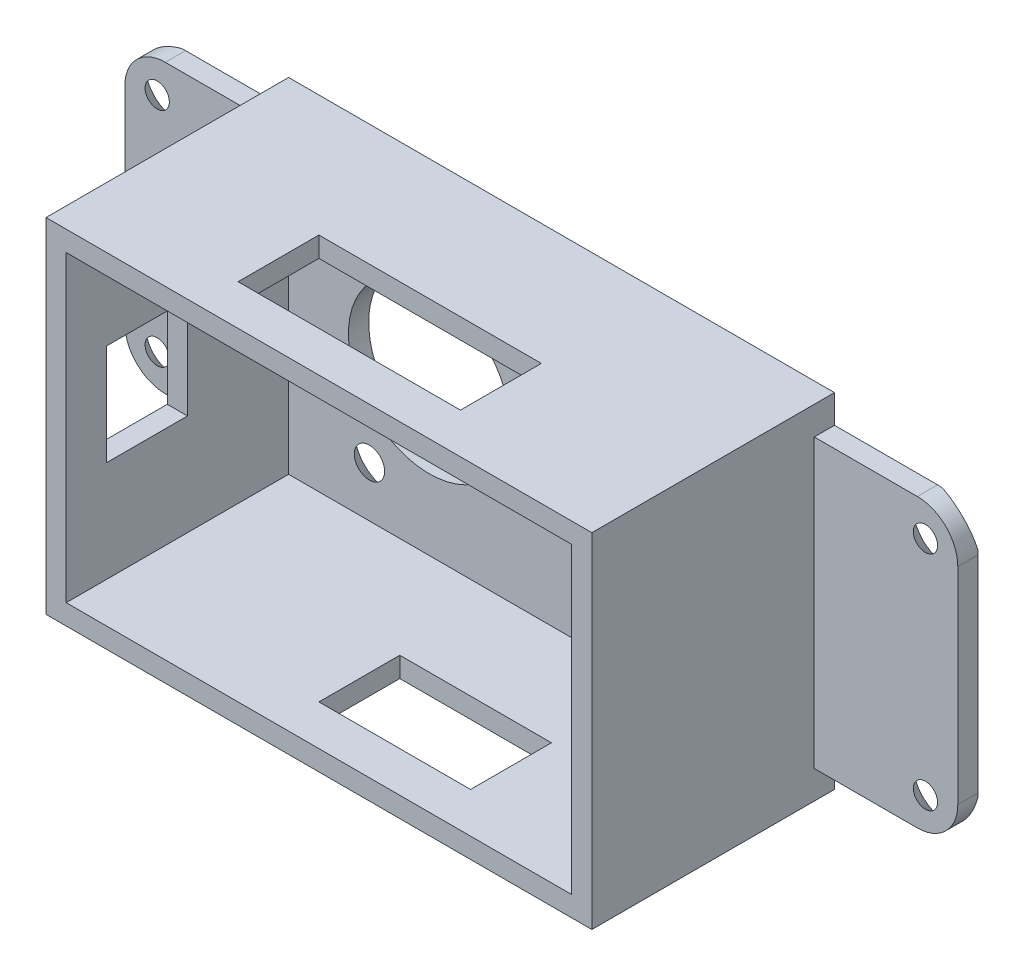
from build123d import *

# Parameters (mm, degrees)
ESBO_O1_W                = 54
ESBO_O1_H                = 34
RESSALTO_EXTRUS_O1_DEPTH = 2
ESBO_O2_W                = 54
ESBO_O2_H                = 34
ESBO_O2_W_2              = 50
ESBO_O2_H_2              = 30
RESSALTO_EXTRUS_O2_DEPTH = 22
ESBO_O3_R                = 1.5
CORTE_EXTRUS_O1_DEPTH    = 4
ESBO_O4_R                = 1.5
CORTE_EXTRUS_O2_DEPTH    = 4
ESBO_O5_R                = 7
CORTE_EXTRUS_O3_DEPTH    = 4
ESBO_O7_W                = 22
ESBO_O7_H                = 8
CORTE_EXTRUS_O4_DEPTH    = 4
ESBO_O8_W                = 15
ESBO_O8_H                = 8
CORTE_EXTRUS_O5_DEPTH    = 4
ESBO_O9_W                = 8
ESBO_O9_H                = 10
CORTE_EXTRUS_O6_DEPTH    = 4
ESBO_O10_W               = 15
ESBO_O10_H               = 34
RESSALTO_EXTRUS_O3_DEPTH = 2
ESBO_O11_W               = 0.5
ESBO_O11_H               = 34
CORTE_EXTRUS_O7_DEPTH    = 4
ESBO_O12_R               = 1.2
CORTE_EXTRUS_O8_DEPTH    = 4
ESBO_O13_R               = 1.5
CORTE_EXTRUS_O9_DEPTH    = 10
ESBO_O14_W               = 18.172080502
ESBO_O14_H               = 24.820402638
RESSALTO_EXTRUS_O4_DEPTH = 2
ESBO_O15_W               = 4.609503347
ESBO_O15_H               = 25.795489883
RESSALTO_EXTRUS_O5_DEPTH = 2
ESBO_O16_R               = 8
CORTE_EXTRUS_O10_DEPTH   = 2
ESBO_O17_W               = 14.5
ESBO_O17_H               = 2.8
CORTE_EXTRUS_O11_DEPTH   = 10
ESBO_O18_W               = 0.3
ESBO_O18_H               = 28.4
CORTE_EXTRUS_O12_DEPTH   = 10
FILETE1_R                = 4
ESBO_O19_W               = 2
ESBO_O19_H               = 8
RESSALTO_EXTRUS_O6_DEPTH = 2
CHANFRO3_SIZE            = 2
CHANFRO4_SIZE            = 2
CHANFRO5_SIZE            = 2
CHANFRO7_SIZE            = 2
CORTE_EXTRUS_O13_DEPTH   = 0.5


# Some blends are built 0.0001 mm under size
with BuildPart() as part:
    # Esboço1 → Ressalto-extrusão1 (new body)
    with BuildSketch(Plane.XY):
        with Locations((27, 17)):
            Rectangle(ESBO_O1_W, ESBO_O1_H)
    extrude(amount=RESSALTO_EXTRUS_O1_DEPTH)

    # Esboço2 → Ressalto-extrusão2 (add)
    with BuildSketch(Plane.XY.offset(2)):
        with Locations((27, 17)):
            Rectangle(ESBO_O2_W, ESBO_O2_H)
        with Locations((27, 17)):
            Rectangle(ESBO_O2_W_2, ESBO_O2_H_2, mode=Mode.SUBTRACT)
    extrude(amount=RESSALTO_EXTRUS_O2_DEPTH)

    # Esboço3 → Corte-extrusão1 (cut)
    with BuildSketch(Plane.XY.offset(2)):
        with Locations((48, 27)):
            Circle(ESBO_O3_R)
        with Locations((48, 7)):
            Circle(ESBO_O3_R)
    extrude(amount=-CORTE_EXTRUS_O1_DEPTH, mode=Mode.SUBTRACT)

    # Esboço4 → Corte-extrusão2 (cut)
    with BuildSketch(Plane.XY.offset(2)):
        with Locations((14, 7)):
            Circle(ESBO_O4_R)
        with Locations((14, 27)):
            Circle(ESBO_O4_R)
    extrude(amount=-CORTE_EXTRUS_O2_DEPTH, mode=Mode.SUBTRACT)

    # Esboço5 → Corte-extrusão3 (cut)
    with BuildSketch(Plane.XY.offset(2)):
        with Locations((19.92, 17)):
            Circle(ESBO_O5_R)
    extrude(amount=-CORTE_EXTRUS_O3_DEPTH, mode=Mode.SUBTRACT)

    # Esboço7 → Corte-extrusão4 (cut)
    with BuildSketch(Plane(origin=(0, 34, 0), x_dir=(1, 0, 0), z_dir=(0, 1, 0))):
        with Locations((26, -16)):
            Rectangle(ESBO_O7_W, ESBO_O7_H)
    extrude(amount=-CORTE_EXTRUS_O4_DEPTH, mode=Mode.SUBTRACT)

    # Esboço8 → Corte-extrusão5 (cut)
    with BuildSketch(Plane(origin=(0, 0, 0), x_dir=(-1, 0, 0), z_dir=(0, -1, 0))):
        with Locations((-30.5, -16)):
            Rectangle(ESBO_O8_W, ESBO_O8_H)
    extrude(amount=-CORTE_EXTRUS_O5_DEPTH, mode=Mode.SUBTRACT)

    # Esboço9 → Corte-extrusão6 (cut)
    with BuildSketch(Plane.ZY):
        with Locations((16, 17)):
            Rectangle(ESBO_O9_W, ESBO_O9_H)
    extrude(amount=-CORTE_EXTRUS_O6_DEPTH, mode=Mode.SUBTRACT)

    # Esboço10 → Ressalto-extrusão3 (add)
    with BuildSketch(Plane(origin=(0, 0, 0), x_dir=(-1, 0, 0), z_dir=(0, 0, -1))):
        Polygon((-69, 0), (-54, 0), (-54, 34), (-69, 34), (-69, 17), align=None)
        with Locations((7.5, 17)):
            Rectangle(ESBO_O10_W, ESBO_O10_H)
    extrude(amount=-RESSALTO_EXTRUS_O3_DEPTH)

    # Esboço11 → Corte-extrusão7 (cut)
    with BuildSketch(Plane(origin=(0, 0, 0), x_dir=(-1, 0, 0), z_dir=(0, 0, -1))):
        with Locations((-68.75, 17)):
            Rectangle(ESBO_O11_W, ESBO_O11_H)
        with Locations((14.75, 17)):
            Rectangle(ESBO_O11_W, ESBO_O11_H)
    extrude(amount=-CORTE_EXTRUS_O7_DEPTH, mode=Mode.SUBTRACT)

    # Esboço12 → Corte-extrusão8 (cut)
    with BuildSketch(Plane(origin=(0, 0, 0), x_dir=(-1, 0, 0), z_dir=(0, 0, -1))):
        with Locations((-65, 28)):
            Circle(ESBO_O12_R)
        with Locations((-65, 6)):
            Circle(ESBO_O12_R)
        with Locations((11, 6)):
            Circle(ESBO_O12_R)
        with Locations((11, 28)):
            Circle(ESBO_O12_R)
    extrude(amount=-CORTE_EXTRUS_O8_DEPTH, mode=Mode.SUBTRACT)

    # Esboço13 → Corte-extrusão9 (cut)
    with BuildSketch(Plane.XY.offset(2)):
        with Locations((44, 27)):
            Circle(ESBO_O13_R)
        with Locations((44, 7)):
            Circle(ESBO_O13_R)
        with Locations((10, 27)):
            Circle(ESBO_O13_R)
        with Locations((10, 7)):
            Circle(ESBO_O13_R)
    extrude(amount=-CORTE_EXTRUS_O9_DEPTH, mode=Mode.SUBTRACT)

    # Esboço14 → Ressalto-extrusão4 (add)
    with BuildSketch(Plane.XY.offset(2)):
        with Locations((20.750577193, 17.221610738)):
            Rectangle(ESBO_O14_W, ESBO_O14_H)
    extrude(amount=-RESSALTO_EXTRUS_O4_DEPTH)

    # Esboço15 → Ressalto-extrusão5 (add)
    with BuildSketch(Plane.XY.offset(2)):
        with Locations((48.363275128, 16.64542282)):
            Rectangle(ESBO_O15_W, ESBO_O15_H)
    extrude(amount=-RESSALTO_EXTRUS_O5_DEPTH)

    # Esboço16 → Corte-extrusão10 (cut)
    with BuildSketch(Plane.XY.offset(2)):
        with Locations((15.92, 17)):
            Circle(ESBO_O16_R)
    extrude(amount=-CORTE_EXTRUS_O10_DEPTH, mode=Mode.SUBTRACT)

    # Esboço17 → Corte-extrusão11 (cut)
    with BuildSketch(Plane.XY.offset(2)):
        with Locations((-7.25, 32.6)):
            Rectangle(ESBO_O17_W, ESBO_O17_H)
        with Locations((61.25, 32.6)):
            Rectangle(ESBO_O17_W, ESBO_O17_H)
        with Locations((61.25, 1.4)):
            Rectangle(ESBO_O17_W, ESBO_O17_H)
        with Locations((-7.25, 1.4)):
            Rectangle(ESBO_O17_W, ESBO_O17_H)
    extrude(amount=-CORTE_EXTRUS_O11_DEPTH, mode=Mode.SUBTRACT)

    # Esboço18 → Corte-extrusão12 (cut)
    with BuildSketch(Plane.XY.offset(2)):
        with Locations((-14.35, 17)):
            Rectangle(ESBO_O18_W, ESBO_O18_H)
        with Locations((68.35, 17)):
            Rectangle(ESBO_O18_W, ESBO_O18_H)
    extrude(amount=-CORTE_EXTRUS_O12_DEPTH, mode=Mode.SUBTRACT)

    # Filete1
    filete1_edges = [part.edges().sort_by_distance(p)[0] for p in [
        (-14.2, 2.8, 1),
        (68.2, 2.8, 1),
        (-14.2, 31.2, 1),
        (68.2, 31.2, 1),
    ]]
    fillet(filete1_edges, radius=FILETE1_R)

    # Esboço19 → Ressalto-extrusão6 (add)
    with BuildSketch(Plane(origin=(0, 34, 0), x_dir=(1, 0, 0), z_dir=(0, 1, 0))):
        with Locations((38, -16)):
            Rectangle(ESBO_O19_W, ESBO_O19_H)
    extrude(amount=-RESSALTO_EXTRUS_O6_DEPTH)

    # Chanfro3
    chanfro3_edges = [part.edges().sort_by_distance(p)[0] for p in [
        (8.5, 7, 0),
    ]]
    chamfer(chanfro3_edges, length=CHANFRO3_SIZE - 0.0001)  # a hair under: the kernel refuses the full size

    # Chanfro4
    chanfro4_edges = [part.edges().sort_by_distance(p)[0] for p in [
        (42.5, 7, 0),
    ]]
    chamfer(chanfro4_edges, length=CHANFRO4_SIZE - 0.0001)  # a hair under: the kernel refuses the full size

    # Chanfro5
    # the kernel refuses this chamfer: 2 mm, written as the material it takes off along each edge
    with BuildSketch(Plane(origin=(65, 6, 0), x_dir=(-1, 0, 0), z_dir=(0, -1, 0))) as chanfro5_piece_1:
        Polygon((1.2 + CHANFRO5_SIZE, 0), (1.2, -CHANFRO5_SIZE), (1.2, 0), align=None)
    revolve(axis=Axis((65, 6, 0), (0, 0, -1)), mode=Mode.SUBTRACT)
    with BuildSketch(Plane(origin=(65, 28, 0), x_dir=(-1, 0, 0), z_dir=(0, -1, 0))) as chanfro5_piece_2:
        Polygon((1.2 + CHANFRO5_SIZE, 0), (1.2, -CHANFRO5_SIZE), (1.2, 0), align=None)
    revolve(axis=Axis((65, 28, 0), (0, 0, -1)), mode=Mode.SUBTRACT)
    with BuildSketch(Plane(origin=(10, 27, 0), x_dir=(1, 0, 0), z_dir=(0, -1, 0))) as chanfro5_piece_3:
        Polygon((1.5 + CHANFRO5_SIZE, 0), (1.5, CHANFRO5_SIZE), (1.5, 0), align=None)
    revolve(axis=Axis((10, 27, 0), (0, 0, 1)), mode=Mode.SUBTRACT)
    with BuildSketch(Plane(origin=(44, 27, 0), x_dir=(1, 0, 0), z_dir=(0, -1, 0))) as chanfro5_piece_4:
        Polygon((1.5 + CHANFRO5_SIZE, 0), (1.5, CHANFRO5_SIZE), (1.5, 0), align=None)
    revolve(axis=Axis((44, 27, 0), (0, 0, 1)), mode=Mode.SUBTRACT)

    # Chanfro7
    # the kernel refuses this chamfer: 2 mm, written as the material it takes off along each edge
    with BuildSketch(Plane(origin=(-11, 28, 0), x_dir=(-1, 0, 0), z_dir=(0, -1, 0))) as chanfro7_piece_1:
        Polygon((1.2 + CHANFRO7_SIZE, 0), (1.2, -CHANFRO7_SIZE), (1.2, 0), align=None)
    revolve(axis=Axis((-11, 28, 0), (0, 0, -1)), mode=Mode.SUBTRACT)
    with BuildSketch(Plane(origin=(-11, 6, 0), x_dir=(-1, 0, 0), z_dir=(0, -1, 0))) as chanfro7_piece_2:
        Polygon((1.2 + CHANFRO7_SIZE, 0), (1.2, -CHANFRO7_SIZE), (1.2, 0), align=None)
    revolve(axis=Axis((-11, 6, 0), (0, 0, -1)), mode=Mode.SUBTRACT)

    # Esboço20 → Corte-extrusão13 (cut)
    # profile 1 of 9: a face of its own
    with BuildSketch(Plane(origin=(0, 0, 0), x_dir=(-1, 0, 0), z_dir=(0, 0, -1))):
        with BuildLine():
            Line((-64.341648744, 17.170569536), (-63.253310638, 16.562033945))
            add(Edge.make_bspline(
                [(-63.253310638, 16.562033945), (-63.270020556, 17.33554905), (-62.813419169, 18.489492684), (-61.807502214, 19.759396766), (-60.143049425, 20.961016733), (-58.489526243, 21.257442003), (-57.325086229, 20.995462515)],
                knots=[0, 0, 0, 0, 0.269048478, 0.436762832, 0.575078585, 1, 1, 1, 1], degree=3))
            add(Edge.make_bspline(
                [(-57.325086229, 20.995462515), (-56.650111252, 20.957693306), (-57.782985527, 21.288511272)],
                knots=[0, 0, 0, 1, 1, 1], degree=2))
            add(Edge.make_bspline(
                [(-57.782985527, 21.288511272), (-58.347802927, 21.447990439), (-59.878608985, 21.522292306), (-61.356202699, 21.053790774), (-62.150011012, 20.559292652)],
                knots=[0, 0, 0, 0, 0.385958971, 1, 1, 1, 1], degree=3))
            add(Edge.make_bspline(
                [(-62.150011012, 20.559292652), (-62.7877961, 20.128686199), (-63.253310638, 19.519599113)],
                knots=[0, 0, 0, 1, 1, 1], degree=2))
            add(Edge.make_bspline(
                [(-63.253310638, 19.519599113), (-63.896310724, 19.534543448), (-64.816721669, 19.466477979), (-66.082799255, 19.167755988), (-66.928993529, 18.906271975), (-67.591738491, 18.342841648), (-67.716909049, 17.554159212), (-67.201169221, 16.709575449), (-66.034826519, 15.798936837), (-65.043136259, 15.137590569), (-64.341648744, 14.82717935)],
                knots=[0, 0, 0, 0, 0.199805318, 0.283821629, 0.403978318, 0.472066119, 0.541253762, 0.630997506, 0.763360147, 1, 1, 1, 1], degree=3))
            add(Edge.make_bspline(
                [(-64.341648744, 14.82717935), (-64.271185726, 13.977816701), (-63.500872393, 12.655393424), (-61.867914467, 11.402421013), (-60.031444391, 10.597092063), (-58.643927495, 10.724275687), (-57.908403654, 10.824357369)],
                knots=[0, 0, 0, 0, 0.29975622, 0.520241987, 0.730809474, 1, 1, 1, 1], degree=3))
            add(Edge.make_bspline(
                [(-57.908403654, 10.824357369), (-57.552932155, 10.91131631), (-58.093396597, 10.909757264)],
                knots=[0, 0, 0, 1, 1, 1], degree=2))
            add(Edge.make_bspline(
                [(-58.093396597, 10.909757264), (-58.597138627, 10.921165487), (-59.359693088, 10.989296436), (-60.51894411, 11.412230368), (-61.854197866, 12.247879996), (-62.594602543, 13.376988435), (-62.908556765, 14.13614406)],
                knots=[0, 0, 0, 0, 0.246282106, 0.366938776, 0.598193981, 1, 1, 1, 1], degree=3))
            add(Edge.make_bspline(
                [(-62.908556765, 14.13614406), (-62.07018749, 13.883830813), (-60.782949289, 13.279057457), (-58.842303432, 12.829318761), (-57.308894504, 12.465946458), (-55.73038208, 12.174490979), (-53.731864974, 11.780344634), (-52.15811274, 11.685675227), (-51.156439711, 11.599039125)],
                knots=[0, 0, 0, 0, 0.217613669, 0.350859611, 0.494055954, 0.609441159, 0.749783707, 1, 1, 1, 1], degree=3))
            add(Edge.make_bspline(
                [(-51.156439711, 11.599039125), (-50.565418006, 11.571750557), (-51.489168444, 11.73385607)],
                knots=[0, 0, 0, 1, 1, 1], degree=2))
            add(Edge.make_bspline(
                [(-51.489168444, 11.73385607), (-52.362535462, 11.967042102), (-53.881877975, 12.37270648), (-56.077202541, 13.064524773), (-58.0955537, 13.745776856), (-60.240047229, 14.470030905), (-62.612522445, 15.508519024), (-64.470021974, 16.25198519), (-65.888206899, 17.642327818), (-65.124947829, 18.509213539), (-64.401736383, 18.935173102), (-63.857541949, 19.102726949), (-63.573361471, 19.058890062)],
                knots=[0, 0, 0, 0, 0.14943301, 0.259821698, 0.380461345, 0.501235571, 0.635113932, 0.801941109, 0.854496238, 0.910360712, 0.953252466, 1, 1, 1, 1], degree=3))
            add(Edge.make_bspline(
                [(-63.573361471, 19.058890062), (-63.82901343, 18.738418293), (-64.118386916, 18.111949736), (-64.312631636, 17.450285411), (-64.341648744, 17.170569536)],
                knots=[0, 0, 0, 0, 0.591386289, 1, 1, 1, 1], degree=3))
        make_face()
    # profile 2 of 9: a face of its own
    with BuildSketch(Plane(origin=(0, 0, 0), x_dir=(-1, 0, 0), z_dir=(0, 0, -1))):
        with BuildLine():
            Line((-58.77564974, 18.060259572), (-56.101515737, 18.060259572))
            Line((-56.101515737, 18.060259572), (-56.016312523, 18.762062937))
            Line((-56.016312523, 18.762062937), (-58.938786283, 18.772498652))
            add(Edge.make_bspline(
                [(-58.938786283, 18.772498652), (-59.449114022, 18.662346686), (-59.868523704, 17.727035504), (-59.248418664, 16.974858294), (-58.882320278, 16.86630174)],
                knots=[0, 0, 0, 0, 0.54475329, 1, 1, 1, 1], degree=3))
            Line((-58.882320278, 16.86630174), (-56.734939991, 16.86630174))
            add(Edge.make_bspline(
                [(-56.734939991, 16.393586892), (-56.436095176, 16.611687057), (-56.734939991, 16.86630174)],
                knots=[0, 0, 0, 1, 1, 1], degree=2))
            Line((-56.734939991, 16.393586892), (-59.452603219, 16.393586892))
            Line((-59.452603219, 16.393586892), (-59.597581247, 15.694978548))
            Line((-59.597581247, 15.694978548), (-56.619507795, 15.694978548))
            add(Edge.make_bspline(
                [(-56.619507795, 17.555217314), (-55.753830359, 17.431820921), (-55.66879501, 15.950374101), (-56.619507795, 15.694978548)],
                knots=[0, 0, 0, 0, 1, 1, 1, 1], degree=3))
            Line((-56.619507795, 17.555217314), (-58.77564974, 17.555217314))
            add(Edge.make_bspline(
                [(-58.77564974, 18.060259572), (-58.937193472, 17.944800948), (-58.944156276, 17.668426138), (-58.77564974, 17.555217314)],
                knots=[0, 0, 0, 0, 1, 1, 1, 1], degree=3))
        make_face()
    # profile 3 of 9: a face of its own
    with BuildSketch(Plane(origin=(0, 0, 0), x_dir=(-1, 0, 0), z_dir=(0, 0, -1))):
        with BuildLine():
            Line((-55.138481136, 18.762062937), (-55.138481136, 18.060259572))
            Line((-55.138481136, 18.060259572), (-52.132489773, 18.060259572))
            add(Edge.make_bspline(
                [(-52.132489773, 18.060259572), (-51.862020444, 17.936540453), (-51.914614766, 17.56996039), (-52.101734743, 17.411237838)],
                knots=[0, 0, 0, 0, 1, 1, 1, 1], degree=3))
            Line((-52.101734743, 17.411237838), (-54.683118266, 17.411237838))
            add(Edge.make_bspline(
                [(-54.683118266, 17.411237838), (-54.888072601, 17.408515629), (-55.131403748, 17.222296939), (-55.102966038, 16.999988217)],
                knots=[0, 0, 0, 0, 1, 1, 1, 1], degree=3))
            Line((-55.102966038, 16.999988217), (-55.102966038, 15.694978548))
            Line((-55.102966038, 15.694978548), (-54.405671123, 15.694978548))
            Line((-54.405671123, 15.694978548), (-54.405671123, 16.598144366))
            add(Edge.make_bspline(
                [(-54.325984863, 16.707005318), (-54.436423373, 16.722519532), (-54.405671123, 16.598144366)],
                knots=[0, 0, 0, 1, 1, 1], degree=2))
            Line((-54.325984863, 16.707005318), (-52.035073316, 16.707005318))
            add(Edge.make_bspline(
                [(-52.132489773, 18.772498652), (-51.749440216, 18.83821921), (-51.389763079, 18.37455441), (-51.225624941, 17.447784669), (-51.582977848, 16.809744391), (-52.035073316, 16.707005318)],
                knots=[0, 0, 0, 0, 0.351621802, 0.539318988, 1, 1, 1, 1], degree=3))
            Line((-52.132489773, 18.772498652), (-55.138481136, 18.762062937))
        make_face()
    # profile 4 of 9: a face of its own
    with BuildSketch(Plane(origin=(0, 0, 0), x_dir=(-1, 0, 0), z_dir=(0, 0, -1))):
        with BuildLine():
            Line((-50.479863026, 15.74914417), (-49.784461806, 15.74914417))
            Line((-49.784461806, 15.74914417), (-49.784461806, 17.828784413))
            Line((-49.784461806, 17.828784413), (-49.784461806, 17.985139175))
            add(Edge.make_bspline(
                [(-49.609519644, 18.121562497), (-49.772566394, 18.130030619), (-49.784461806, 17.985139175)],
                knots=[0, 0, 0, 1, 1, 1], degree=2))
            Line((-49.609519644, 18.121562497), (-47.689755505, 18.121562497))
            add(Edge.make_bspline(
                [(-47.689755505, 18.121562497), (-47.408859153, 18.147268522), (-47.39266069, 17.911336855)],
                knots=[0, 0, 0, 1, 1, 1], degree=2))
            Line((-47.39266069, 17.911336855), (-47.39266069, 17.393731077))
            Line((-47.39266069, 17.393731077), (-49.031563603, 17.393731077))
            add(Edge.make_bspline(
                [(-49.031563603, 17.393731077), (-49.42142062, 17.180146742), (-49.446968138, 16.707005318)],
                knots=[0, 0, 0, 1, 1, 1], degree=2))
            Line((-49.446968138, 16.707005318), (-47.39266069, 16.707005318))
            Line((-47.39266069, 16.707005318), (-47.39266069, 15.74914417))
            Line((-47.39266069, 15.74914417), (-46.750203992, 15.74914417))
            Line((-46.750203992, 15.74914417), (-46.750203992, 17.985139175))
            add(Edge.make_bspline(
                [(-47.519557182, 18.807686151), (-47.057389047, 18.841848308), (-46.751788692, 18.392170006), (-46.750203992, 17.985139175)],
                knots=[0, 0, 0, 0, 1, 1, 1, 1], degree=3))
            Line((-47.519557182, 18.807686151), (-49.77936236, 18.772498652))
            add(Edge.make_bspline(
                [(-50.479863026, 18.060259572), (-50.470269191, 18.426072019), (-50.129660642, 18.730973168), (-49.77936236, 18.772498652)],
                knots=[0, 0, 0, 0, 1, 1, 1, 1], degree=3))
            Line((-50.479863026, 18.060259572), (-50.479863026, 15.74914417))
        make_face()
    # profile 5 of 9: a face of its own
    with BuildSketch(Plane(origin=(0, 0, 0), x_dir=(-1, 0, 0), z_dir=(0, 0, -1))):
        Polygon((-41.784382899, 18.902165869), (-41.784382899, 15.74914417), (-38.508681711, 15.74914417), (-38.679885606, 16.492022096), (-41.053912948, 16.492022096), (-41.053912948, 16.999988217), (-38.679885606, 16.999988217), (-38.679885606, 17.69766513), (-41.064126903, 17.69766513), (-41.064126903, 18.121562497), (-38.679885606, 18.121562497), (-38.508681711, 18.902165869), align=None)
    # profile 6 of 9: a face of its own
    with BuildSketch(Plane(origin=(0, 0, 0), x_dir=(-1, 0, 0), z_dir=(0, 0, -1))):
        with BuildLine():
            Line((-45.228681361, 17.911336855), (-45.228681361, 16.707005318))
            add(Edge.make_bspline(
                [(-45.228681361, 16.707005318), (-45.24009694, 16.50837399), (-45.002836003, 16.492022096)],
                knots=[0, 0, 0, 1, 1, 1], degree=2))
            Line((-45.002836003, 16.492022096), (-42.734067235, 16.492022096))
            Line((-42.734067235, 16.492022096), (-42.570583826, 15.74914417))
            Line((-42.570583826, 15.74914417), (-45.045841303, 15.74914417))
            add(Edge.make_bspline(
                [(-45.9815973, 16.598144366), (-45.860648176, 15.842462886), (-45.045841303, 15.74914417)],
                knots=[0, 0, 0, 1, 1, 1], degree=2))
            Line((-45.9815973, 16.598144366), (-45.9815973, 17.985139175))
            add(Edge.make_bspline(
                [(-45.9815973, 17.985139175), (-45.814921702, 18.685525436), (-45.088520209, 18.855003395)],
                knots=[0, 0, 0, 1, 1, 1], degree=2))
            Line((-45.088520209, 18.855003395), (-42.620256819, 18.855003395))
            Line((-42.620256819, 18.855003395), (-42.734067235, 18.121562497))
            Line((-42.734067235, 18.121562497), (-45.045841303, 18.121562497))
            add(Edge.make_bspline(
                [(-45.228681361, 17.911336855), (-45.225390296, 18.086029314), (-45.045841303, 18.121562497)],
                knots=[0, 0, 0, 1, 1, 1], degree=2))
        make_face()
    # profile 7 of 9: a face of its own
    with BuildSketch(Plane(origin=(0, 0, 0), x_dir=(-1, 0, 0), z_dir=(0, 0, -1))):
        with BuildLine():
            Line((-37.054942905, 18.902165869), (-37.054942905, 16.707005318))
            add(Edge.make_bspline(
                [(-37.054942905, 16.707005318), (-37.047395057, 16.405252403), (-36.779235698, 16.492022096)],
                knots=[0, 0, 0, 1, 1, 1], degree=2))
            Line((-36.779235698, 16.492022096), (-34.838681127, 16.492022096))
            Line((-34.838681127, 16.492022096), (-34.65841103, 15.830327683))
            Line((-34.65841103, 15.830327683), (-37.054942905, 15.830327683))
            add(Edge.make_bspline(
                [(-37.797231538, 16.492022096), (-37.666605717, 15.886091932), (-37.054942905, 15.830327683)],
                knots=[0, 0, 0, 1, 1, 1], degree=2))
            Line((-37.797231538, 16.492022096), (-37.797231538, 18.03836676))
            add(Edge.make_bspline(
                [(-37.054942905, 18.902165869), (-37.783700117, 18.901057398), (-37.797231538, 18.03836676)],
                knots=[0, 0, 0, 1, 1, 1], degree=2))
        make_face()
    # profile 8 of 9: a face of its own
    with BuildSketch(Plane(origin=(0, 0, 0), x_dir=(-1, 0, 0), z_dir=(0, 0, -1))):
        with BuildLine():
            Line((-33.874838048, 15.830327683), (-33.138391362, 15.830327683))
            Line((-33.138391362, 15.830327683), (-33.138391362, 18.03836676))
            add(Edge.make_bspline(
                [(-33.138391362, 18.03836676), (-33.088269409, 18.155651668), (-32.962796333, 18.195311744)],
                knots=[0, 0, 0, 1, 1, 1], degree=2))
            Line((-32.962796333, 18.195311744), (-31.027385677, 18.195311744))
            add(Edge.make_bspline(
                [(-31.027385677, 18.195311744), (-30.894413047, 18.192014701), (-30.832792377, 18.07327202)],
                knots=[0, 0, 0, 1, 1, 1], degree=2))
            Line((-30.832792377, 18.07327202), (-30.832792377, 17.500130127))
            Line((-30.832792377, 17.500130127), (-32.394460091, 17.500130127))
            add(Edge.make_bspline(
                [(-32.394460091, 17.500130127), (-32.661794524, 17.486374589), (-32.737893836, 17.170569536)],
                knots=[0, 0, 0, 1, 1, 1], degree=2))
            Line((-32.737893836, 17.170569536), (-32.842436457, 16.800848717))
            Line((-32.842436457, 16.800848717), (-30.832792377, 16.800848717))
            Line((-30.832792377, 16.800848717), (-30.832792377, 15.830327683))
            Line((-30.832792377, 15.830327683), (-30.127400065, 15.830327683))
            Line((-30.127400065, 15.830327683), (-30.127400065, 18.164493008))
            add(Edge.make_bspline(
                [(-30.832792377, 18.902165869), (-30.273299336, 18.746375059), (-30.127400065, 18.164493008)],
                knots=[0, 0, 0, 1, 1, 1], degree=2))
            Line((-30.832792377, 18.902165869), (-33.138391362, 18.902165869))
            add(Edge.make_bspline(
                [(-33.874838048, 18.03836676), (-33.849333282, 18.432884196), (-33.591715365, 18.901676127), (-33.138391362, 18.902165869)],
                knots=[0, 0, 0, 0, 1, 1, 1, 1], degree=3))
            Line((-33.874838048, 18.03836676), (-33.874838048, 15.830327683))
        make_face()
    # profile 9 of 9: a face of its own
    with BuildSketch(Plane(origin=(0, 0, 0), x_dir=(-1, 0, 0), z_dir=(0, 0, -1))):
        with BuildLine():
            Line((-29.318901819, 18.195311744), (-29.318901819, 15.830327683))
            Line((-29.318901819, 15.830327683), (-26.103026938, 15.892823673))
            add(Edge.make_bspline(
                [(-25.869038833, 17.393731077), (-25.589437407, 17.27972255), (-25.354386617, 16.607911237), (-25.69011562, 15.979544365), (-26.103026938, 15.892823673)],
                knots=[0, 0, 0, 0, 0.432290973, 1, 1, 1, 1], degree=3))
            add(Edge.make_bspline(
                [(-26.254328608, 18.904733461), (-25.931814069, 18.878082889), (-25.396081572, 18.38331141), (-25.546902684, 17.590303916), (-25.869038833, 17.393731077)],
                knots=[0, 0, 0, 0, 0.454861815, 1, 1, 1, 1], degree=3))
            Line((-26.254328608, 18.904733461), (-28.806226114, 18.904733461))
            add(Edge.make_bspline(
                [(-29.318901819, 18.195311744), (-29.267571286, 18.673057578), (-28.806226114, 18.904733461)],
                knots=[0, 0, 0, 1, 1, 1], degree=2))
        make_face()
        with BuildLine():
            Line((-28.61449442, 18.195311744), (-28.61449442, 17.751959426))
            Line((-28.61449442, 17.751959426), (-26.346795122, 17.751959426))
            add(Edge.make_bspline(
                [(-26.434690444, 18.195311744), (-26.202612478, 18.240551903), (-26.142538929, 17.816608558), (-26.346795122, 17.751959426)],
                knots=[0, 0, 0, 0, 1, 1, 1, 1], degree=3))
            Line((-26.434690444, 18.195311744), (-28.61449442, 18.195311744))
        make_face(mode=Mode.SUBTRACT)
        with BuildLine():
            Line((-28.61449442, 16.999988217), (-28.61449442, 16.562033945))
            Line((-28.61449442, 16.562033945), (-26.346795122, 16.562033945))
            add(Edge.make_bspline(
                [(-26.381927299, 16.999988217), (-26.178031483, 16.969664008), (-26.121672389, 16.624284383), (-26.346795122, 16.562033945)],
                knots=[0, 0, 0, 0, 1, 1, 1, 1], degree=3))
            Line((-26.381927299, 16.999988217), (-28.61449442, 16.999988217))
        make_face(mode=Mode.SUBTRACT)
    extrude(amount=-CORTE_EXTRUS_O13_DEPTH, mode=Mode.SUBTRACT)


solid = part.part
